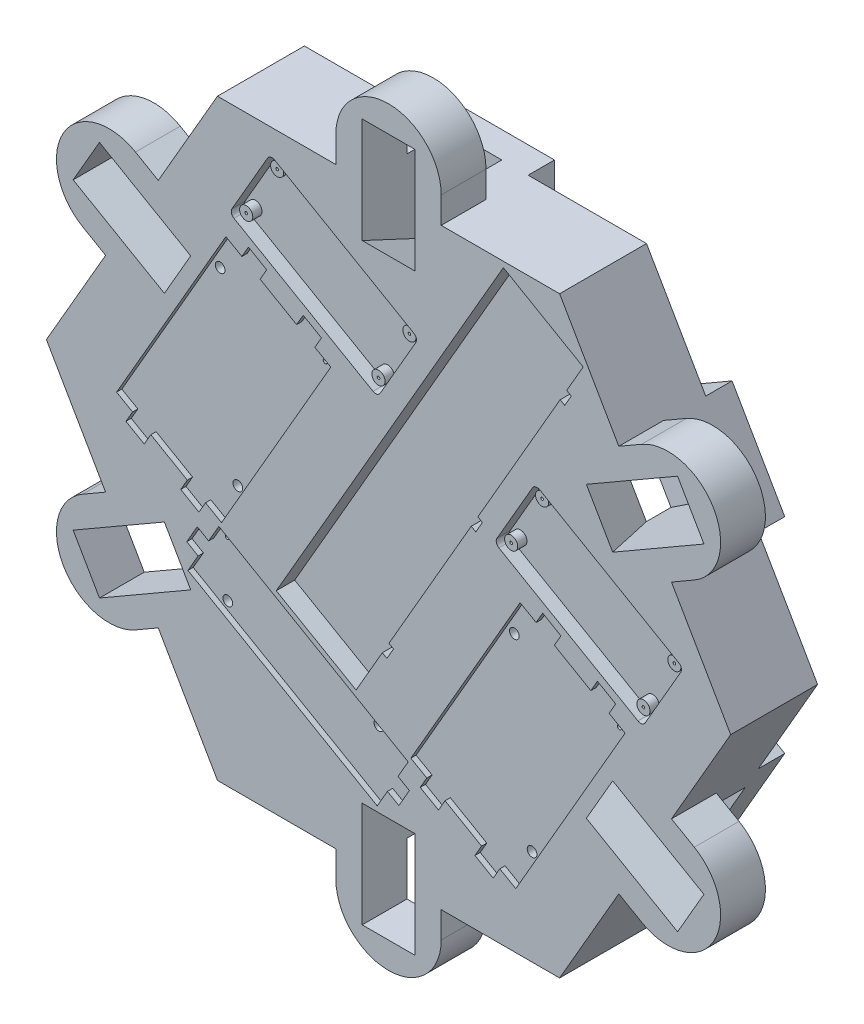
from build123d import *

# Parameters (mm, degrees)
MBODY_DEPTH             = 33
BOTTOMFLOOR_W           = 40
BOTTOMFLOOR_H           = 30
BODYBASE_DEPTH          = 10
SERVOCIRCLE_DEPTH       = 17
BBCUT_DEPTH             = 7
BATTCUT_DEPTH           = 2
BATTFIXTURE_START       = 27.5
BATTFIXTURE_OUTLINE_R   = 1.84
BATTFIXTURE_OUTLINE_R_2 = 0.785
BATTFIXTURE_DEPTH       = 3.5
PCACUT_DEPTH            = 5
SKETCH10_R              = 2.5
SKETCH10_R_2            = 0.5
PCAFIXTURE_DEPTH        = 3.5
HOLLOWBOTTOM_DEPTH      = 20
CUT_EXTRUDE2_DEPTH      = 20
CUT_EXTRUDE5_DEPTH      = 20
CUT_EXTRUDE6_DEPTH      = 20
CUT_EXTRUDE7_DEPTH      = 20
CUT_EXTRUDE8_DEPTH      = 20
CUT_EXTRUDE9_DEPTH      = 20
BOTTOMBATTCUT_DEPTH     = 2
SKETCH20_R              = 1.84
SKETCH20_R_2            = 0.785
BOTTOMBATTFIXTURE_DEPTH = 3.5


# Read off the part's stored shape, not the designer's step: BATTFIXTURE
with BuildPart() as part:
    # HEXAGON → MBODY (new body)
    with BuildSketch(Plane.XY):
        Polygon((85.10734985, -37.472778602), (102.427857926, -47.472778602), (129.903810568, 0.11696736), (102.427857926, 47.706713322), (85.10734985, 37.706713322), (75.10734985, 55.027221398), (92.427857926, 65.027221398), (64.951905284, 112.61696736), (10, 112.61696736), (10, 92.61696736), (-10, 92.61696736), (-10, 112.61696736), (-64.951905284, 112.61696736), (-92.427857926, 65.027221398), (-75.10734985, 55.027221398), (-85.10734985, 37.706713322), (-102.427857926, 47.706713322), (-129.903810568, 0.11696736), (-102.427857926, -47.472778602), (-85.10734985, -37.472778602), (-75.10734985, -54.793286678), (-92.427857926, -64.793286678), (-64.951905284, -112.38303264), (-10, -112.38303264), (-10, -92.38303264), (10, -92.38303264), (10, -112.38303264), (64.951905284, -112.38303264), (92.427857926, -64.793286678), (75.10734985, -54.793286678), align=None)
    extrude(amount=MBODY_DEPTH)

    # BottomFloor → BODYBASE (add)
    with BuildSketch(Plane.XY):
        with Locations((0, -97.38303264)):
            Rectangle(BOTTOMFLOOR_W, BOTTOMFLOOR_H)
        Polygon((87.427857926, -73.453540716), (107.427857926, -38.812524564), (81.447095812, -23.812524564), (61.447095812, -58.453540716), align=None)
        Polygon((-107.427857926, -38.812524564), (-87.427857926, -73.453540716), (-61.447095812, -58.453540716), (-81.447095812, -23.812524564), align=None)
        Polygon((-87.427857926, 73.687475436), (-107.427857926, 39.046459284), (-81.447095812, 24.046459284), (-61.447095812, 58.687475436), align=None)
        with Locations((0, 97.61696736)):
            Rectangle(BOTTOMFLOOR_W, BOTTOMFLOOR_H)
        Polygon((107.427857926, 39.046459284), (87.427857926, 73.687475436), (61.447095812, 58.687475436), (81.447095812, 24.046459284), align=None)
    extrude(amount=-BODYBASE_DEPTH)

    # CircleBits → SERVOCIRCLE (add)
    with BuildSketch(Plane.XY.offset(33)):
        with BuildLine():
            Line((-87.427857926, -73.453540716), (-96.088111964, -78.453540716))
            ThreePointArc((-96.088111964, -78.453540716), (-123.408620039, -71.13303264), (-116.088111964, -43.812524564))
            Line((-116.088111964, -43.812524564), (-107.427857926, -38.812524564))
            Line((-107.427857926, -38.812524564), (-102.427857926, -47.472778602))
            Line((-102.427857926, -47.472778602), (-119.748366001, -57.472778602))
            Line((-119.748366001, -57.472778602), (-109.748366001, -74.793286678))
            Line((-109.748366001, -74.793286678), (-92.427857926, -64.793286678))
            Line((-92.427857926, -64.793286678), (-87.427857926, -73.453540716))
        make_face()
        with BuildLine():
            Line((-20, 112.61696736), (-20, 122.61696736))
            ThreePointArc((-20, 122.61696736), (0, 142.61696736), (20, 122.61696736))
            Line((20, 122.61696736), (20, 112.61696736))
            Line((20, 112.61696736), (10, 112.61696736))
            Line((10, 112.61696736), (10, 132.61696736))
            Line((10, 132.61696736), (-10, 132.61696736))
            Line((-10, 132.61696736), (-10, 112.61696736))
            Line((-10, 112.61696736), (-20, 112.61696736))
        make_face()
        with BuildLine():
            Line((20, -112.38303264), (20, -122.38303264))
            ThreePointArc((20, -122.38303264), (0, -142.38303264), (-20, -122.38303264))
            Line((-20, -122.38303264), (-20, -112.38303264))
            Line((-20, -112.38303264), (-10, -112.38303264))
            Line((-10, -112.38303264), (-10, -132.38303264))
            Line((-10, -132.38303264), (10, -132.38303264))
            Line((10, -132.38303264), (10, -112.38303264))
            Line((10, -112.38303264), (20, -112.38303264))
        make_face()
        with BuildLine():
            Line((87.427857926, 73.687475436), (96.088111964, 78.687475436))
            ThreePointArc((96.088111964, 78.687475436), (123.408620039, 71.36696736), (116.088111964, 44.046459284))
            Line((116.088111964, 44.046459284), (107.427857926, 39.046459284))
            Line((107.427857926, 39.046459284), (102.427857926, 47.706713322))
            Line((102.427857926, 47.706713322), (119.748366001, 57.706713322))
            Line((119.748366001, 57.706713322), (109.748366001, 75.027221398))
            Line((109.748366001, 75.027221398), (92.427857926, 65.027221398))
            Line((92.427857926, 65.027221398), (87.427857926, 73.687475436))
        make_face()
        with BuildLine():
            Line((107.427857926, -38.812524564), (116.088111964, -43.812524564))
            ThreePointArc((116.088111964, -43.812524564), (123.408620039, -71.13303264), (96.088111964, -78.453540716))
            Line((96.088111964, -78.453540716), (87.427857926, -73.453540716))
            Line((87.427857926, -73.453540716), (92.427857926, -64.793286678))
            Line((92.427857926, -64.793286678), (109.748366001, -74.793286678))
            Line((109.748366001, -74.793286678), (119.748366001, -57.472778602))
            Line((119.748366001, -57.472778602), (102.427857926, -47.472778602))
            Line((102.427857926, -47.472778602), (107.427857926, -38.812524564))
        make_face()
        with BuildLine():
            Line((-107.427857926, 39.046459284), (-116.088111964, 44.046459284))
            ThreePointArc((-116.088111964, 44.046459284), (-123.408620039, 71.36696736), (-96.088111964, 78.687475436))
            Line((-96.088111964, 78.687475436), (-87.427857926, 73.687475436))
            Line((-87.427857926, 73.687475436), (-92.427857926, 65.027221398))
            Line((-92.427857926, 65.027221398), (-109.748366001, 75.027221398))
            Line((-109.748366001, 75.027221398), (-119.748366001, 57.706713322))
            Line((-119.748366001, 57.706713322), (-102.427857926, 47.706713322))
            Line((-102.427857926, 47.706713322), (-107.427857926, 39.046459284))
        make_face()
    extrude(amount=-SERVOCIRCLE_DEPTH)

    # Breadboard → BBCUT (cut)
    with BuildSketch(Plane.XY.offset(33)):
        Polygon((-12.320268887, -56.339331676), (-2.344555434, -39.060889132), (-0.612504626, -40.060889132), (1.887495374, -35.730762114), (0.155444566, -34.730762114), (31.405444566, 19.395825623), (33.137495374, 18.395825623), (35.637495374, 22.725952642), (33.905444566, 23.725952642), (65.155444566, 77.852540378), (66.887495374, 76.852540378), (69.387495374, 81.182667397), (67.655444566, 82.182667397), (73.905444566, 93.007984945), (43.594555434, 110.507984945), (-42.63115802, -38.839331676), align=None)
    extrude(amount=-BBCUT_DEPTH, mode=Mode.SUBTRACT)

    # Sketch6 → BATTCUT (cut)
    with BuildSketch(Plane.XY.offset(33)):
        Polygon((49.964340803, 3.540776838), (56.02651863, 0.040776838), (58.52651863, 4.370903857), (65.45472186, 0.370903857), (62.95472186, -3.959223162), (76.811128321, -11.959223162), (79.311128321, -7.629096143), (86.239331551, -11.629096143), (83.739331551, -15.959223162), (89.801509378, -19.459223162), (48.301509378, -91.339331676), (42.239331551, -87.839331676), (39.739331551, -92.169458695), (32.811128321, -88.169458695), (35.311128321, -83.839331676), (21.45472186, -75.839331676), (18.95472186, -80.169458695), (12.02651863, -76.169458695), (14.52651863, -71.839331676), (8.464340803, -68.339331676), align=None)
        Polygon((-64.415767711, -28.571382483), (7.464340803, -70.071382483), (3.589340803, -76.783079363), (7.919467822, -79.283079363), (3.919467822, -86.211282593), (-0.410659197, -83.711282593), (-4.285659197, -90.422979472), (-76.165767711, -48.922979472), (-72.290767711, -42.211282593), (-76.62089473, -39.711282593), (-72.62089473, -32.783079363), (-68.290767711, -35.283079363), align=None)
        Polygon((-61.752936285, 68.040776838), (-55.690758458, 64.540776838), (-53.190758458, 68.870903857), (-46.262555228, 64.870903857), (-48.762555228, 60.540776838), (-34.906148767, 52.540776838), (-32.406148767, 56.870903857), (-25.477945537, 52.870903857), (-27.977945537, 48.540776838), (-21.915767711, 45.040776838), (-63.415767711, -26.839331676), (-69.477945537, -23.339331676), (-71.977945537, -27.669458695), (-78.906148767, -23.669458695), (-76.406148767, -19.339331676), (-90.262555228, -11.339331676), (-92.762555228, -15.669458695), (-99.690758458, -11.669458695), (-97.190758458, -7.339331676), (-103.252936285, -3.839331676), align=None)
    extrude(amount=-BATTCUT_DEPTH, mode=Mode.SUBTRACT)

    # BATTFIXTURE outline → BATTFIXTURE (cut)
    with BuildSketch(Plane.XY.offset(BATTFIXTURE_START)):
        with Locations((45.774917015, -9.715518018)):
            Circle(BATTFIXTURE_OUTLINE_R)
        with Locations((85.690933166, -20.578950008)):
            Circle(BATTFIXTURE_OUTLINE_R_2)
        with Locations((52.490933166, -78.083036819)):
            Circle(BATTFIXTURE_OUTLINE_R)
        with Locations((-59.226343922, -13.583036819)):
            Circle(BATTFIXTURE_OUTLINE_R)
        with Locations((-65.942360073, 54.784481982)):
            Circle(BATTFIXTURE_OUTLINE_R)
        with Locations((-26.026343922, 43.921049992)):
            Circle(BATTFIXTURE_OUTLINE_R_2)
        with Locations((-63.034472854, -53.328909612)):
            Circle(BATTFIXTURE_OUTLINE_R)
        with Locations((-63.171040864, -32.465452344)):
            Circle(BATTFIXTURE_OUTLINE_R_2)
        with Locations((-5.666954053, -65.665452344)):
            Circle(BATTFIXTURE_OUTLINE_R)
    extrude(amount=BATTFIXTURE_DEPTH, mode=Mode.SUBTRACT)

    # Sketch9 → PCACUT (cut)
    with BuildSketch(Plane.XY.offset(33)):
        with BuildLine():
            Line((97.442556229, -12.241945402), (110.942556229, 11.1407405))
            ThreePointArc((110.942556229, 11.1407405), (111.142357074, 12.65837859), (110.210505422, 13.872791308))
            Line((110.210505422, 13.872791308), (57.382955791, 44.372791308))
            ThreePointArc((57.382955791, 44.372791308), (55.865317701, 44.572592153), (54.650904983, 43.6407405))
            Line((54.650904983, 43.6407405), (41.150904983, 20.258054598))
            ThreePointArc((41.150904983, 20.258054598), (40.951104138, 18.740416508), (41.882955791, 17.52600379))
            Line((41.882955791, 17.52600379), (94.710505422, -12.97399621))
            ThreePointArc((94.710505422, -12.97399621), (96.228143512, -13.173797055), (97.442556229, -12.241945402))
        make_face()
        with BuildLine():
            Line((-3.161992845, 45.843775815), (10.338007155, 69.226461717))
            ThreePointArc((10.338007155, 69.226461717), (10.537808, 70.744099807), (9.605956347, 71.958512525))
            Line((9.605956347, 71.958512525), (-43.221593284, 102.458512525))
            ThreePointArc((-43.221593284, 102.458512525), (-44.739231374, 102.65831337), (-45.953644091, 101.726461717))
            Line((-45.953644091, 101.726461717), (-59.453644091, 78.343775815))
            ThreePointArc((-59.453644091, 78.343775815), (-59.653444936, 76.826137725), (-58.721593284, 75.611725007))
            Line((-58.721593284, 75.611725007), (-5.894043653, 45.111725007))
            ThreePointArc((-5.894043653, 45.111725007), (-4.376405562, 44.911924162), (-3.161992845, 45.843775815))
        make_face()
    extrude(amount=-PCACUT_DEPTH, mode=Mode.SUBTRACT)

    # Sketch10 → PCAFIXTURE (add)
    # profile 1 of 8: a face of its own
    with BuildSketch(Plane.XY.offset(28)):
        with Locations((107.036467316, 11.375196043)):
            Circle(SKETCH10_R)
        with Locations((107.036467316, 11.375196043)):
            Circle(SKETCH10_R_2, mode=Mode.SUBTRACT)
    # profile 2 of 8: a face of its own
    with BuildSketch(Plane.XY.offset(28)):
        with Locations((95.286467316, -8.976400945)):
            Circle(SKETCH10_R)
        with Locations((95.286467316, -8.976400945)):
            Circle(SKETCH10_R_2, mode=Mode.SUBTRACT)
    # profile 3 of 8: a face of its own
    with BuildSketch(Plane.XY.offset(28)):
        with Locations((45.056993897, 20.023599055)):
            Circle(SKETCH10_R)
        with Locations((45.056993897, 20.023599055)):
            Circle(SKETCH10_R_2, mode=Mode.SUBTRACT)
    # profile 4 of 8: a face of its own
    with BuildSketch(Plane.XY.offset(28)):
        with Locations((56.806993897, 40.375196043)):
            Circle(SKETCH10_R)
        with Locations((56.806993897, 40.375196043)):
            Circle(SKETCH10_R_2, mode=Mode.SUBTRACT)
    # profile 5 of 8: a face of its own
    with BuildSketch(Plane.XY.offset(28)):
        with Locations((6.431918242, 69.46091726)):
            Circle(SKETCH10_R)
        with Locations((6.431918242, 69.46091726)):
            Circle(SKETCH10_R_2, mode=Mode.SUBTRACT)
    # profile 6 of 8: a face of its own
    with BuildSketch(Plane.XY.offset(28)):
        with Locations((-5.318081758, 49.109320271)):
            Circle(SKETCH10_R)
        with Locations((-5.318081758, 49.109320271)):
            Circle(SKETCH10_R_2, mode=Mode.SUBTRACT)
    # profile 7 of 8: a face of its own
    with BuildSketch(Plane.XY.offset(28)):
        with Locations((-55.547555178, 78.109320271)):
            Circle(SKETCH10_R)
        with Locations((-55.547555178, 78.109320271)):
            Circle(SKETCH10_R_2, mode=Mode.SUBTRACT)
    # profile 8 of 8: a face of its own
    with BuildSketch(Plane.XY.offset(28)):
        with Locations((-43.797555178, 98.46091726)):
            Circle(SKETCH10_R)
        with Locations((-43.797555178, 98.46091726)):
            Circle(SKETCH10_R_2, mode=Mode.SUBTRACT)
    extrude(amount=PCAFIXTURE_DEPTH)

    # Sketch16 → HOLLOWBOTTOM (cut)
    with BuildSketch(Plane(origin=(0, 0, 0), x_dir=(-1, 0, 0), z_dir=(0, 0, -1))):
        Polygon((-47.631397208, -82.38303264), (-61.447095812, -58.453540716), (-81.447095812, -23.812524564), (-95.262794416, 0.11696736), (-81.447095812, 24.046459284), (-61.447095812, 58.687475436), (-47.631397208, 82.61696736), (-20, 82.61696736), (20, 82.61696736), (47.631397208, 82.61696736), (61.447095812, 58.687475436), (81.447095812, 24.046459284), (95.262794416, 0.11696736), (81.447095812, -23.812524564), (61.447095812, -58.453540716), (47.631397208, -82.38303264), (20, -82.38303264), (-20, -82.38303264), align=None)
    extrude(amount=-HOLLOWBOTTOM_DEPTH, mode=Mode.SUBTRACT)

    # Sketch17 → Cut-Extrude2 (cut)
    with BuildSketch(Plane(origin=(10, 0, 0), x_dir=(0, -1, 0), z_dir=(-1, 0, 0))):
        Polygon((92.38303264, 0), (92.38303264, 33), (78.436630003, 3.091843028), align=None)
    extrude(amount=CUT_EXTRUDE2_DEPTH, mode=Mode.SUBTRACT)

    # Sketch21 → Cut-Extrude5 (cut)
    with BuildSketch(Plane(origin=(4.949351647, -8.572528518, 9.898703295), x_dir=(-0.4330127018922194, -0.2500000000000001, -0.8660254037844387), z_dir=(0.5000000000000001, -0.8660254037844386, 0))):
        Polygon((45.142470753, -64.575332389), (26.214448353, -91.60734985), (54.793286678, -75.10734985), align=None)
    extrude(amount=-CUT_EXTRUDE5_DEPTH, mode=Mode.SUBTRACT)

    # Sketch22 → Cut-Extrude6 (cut)
    with BuildSketch(Plane(origin=(-128.320894519, 62.65606497, 33), x_dir=(0.7499999999999993, -0.433012701892219, -0.5000000000000012), z_dir=(-0.5000000000000001, -0.8660254037844386, 0))):
        Polygon((70.245562131, 6.021329248), (43.213544669, 24.949351647), (59.713544669, -3.629486677), align=None)
    extrude(amount=-CUT_EXTRUDE6_DEPTH, mode=Mode.SUBTRACT)

    # Sketch23 → Cut-Extrude7 (cut)
    with BuildSketch(Plane(origin=(-10, -33, 165.457186975), x_dir=(-1.3877787807814417e-15, 0.49999999999999906, -0.8660254037844393), z_dir=(-1, 0, 0))):
        Polygon((196.447794914, -15.526873931), (177.519772514, -42.558891393), (206.098610839, -26.058891393), align=None)
    extrude(amount=-CUT_EXTRUDE7_DEPTH, mode=Mode.SUBTRACT)

    # Sketch24 → Cut-Extrude8 (cut)
    with BuildSketch(Plane(origin=(-143.432957746, -71.147084022, -44.048458457), x_dir=(0.8660254037844378, 0.5000000000000017, 0), z_dir=(0.5000000000000016, -0.8660254037844377, 0))):
        Polygon((252.348610839, 44.048458457), (252.348610839, 77.048458457), (238.402208201, 47.140301485), align=None)
    extrude(amount=CUT_EXTRUDE8_DEPTH, mode=Mode.SUBTRACT)

    # Sketch25 → Cut-Extrude9 (cut)
    with BuildSketch(Plane(origin=(105.819701711, -49.431060525, -74.940850896), x_dir=(-0.75, 0.43301270189221946, 0.49999999999999994), z_dir=(0.5000000000000001, 0.8660254037844386, 0))):
        Polygon((71.806637798, 48.646812023), (74.682777309, 81.52123706), (58.182777309, 52.942398735), align=None)
    extrude(amount=-CUT_EXTRUDE9_DEPTH, mode=Mode.SUBTRACT)

    # Sketch18 → BOTTOMBATTCUT (cut)
    with BuildSketch(Plane.XY.offset(20)):
        Polygon((30.830127019, 43.516313761), (36.892304845, 40.016313761), (39.392304845, 44.346440779), (46.320508076, 40.346440779), (43.820508076, 36.016313761), (57.676914536, 28.016313761), (60.176914536, 32.346440779), (67.105117767, 28.346440779), (64.605117767, 24.016313761), (70.667295593, 20.516313761), (29.167295593, -51.363794754), (23.105117767, -47.863794754), (20.605117767, -52.193921772), (13.676914536, -48.193921772), (16.176914536, -43.863794754), (2.320508076, -35.863794754), (-0.179491924, -40.193921772), (-7.107695155, -36.193921772), (-4.607695155, -31.863794754), (-10.669872981, -28.363794754), align=None)
        Polygon((-56.40217363, -14.574463024), (15.477934884, -56.074463024), (11.602934884, -62.786159903), (15.933061903, -65.286159903), (11.933061903, -72.214363133), (7.602934884, -69.714363133), (3.727934884, -76.426060013), (-68.15217363, -34.926060013), (-64.27717363, -28.214363133), (-68.607300649, -25.714363133), (-64.607300649, -18.786159903), (-60.27717363, -21.286159903), align=None)
        Polygon((-17.688048388, 71.480019271), (-11.625870562, 67.980019271), (-9.125870562, 72.31014629), (-2.197667331, 68.31014629), (-4.697667331, 63.980019271), (9.158739129, 55.980019271), (11.658739129, 60.31014629), (18.586942359, 56.31014629), (16.086942359, 51.980019271), (22.149120186, 48.480019271), (-19.350879814, -23.400089243), (-25.413057641, -19.900089243), (-27.913057641, -24.230216262), (-34.841260871, -20.230216262), (-32.341260871, -15.900089243), (-46.197667331, -7.900089243), (-48.697667331, -12.230216262), (-55.625870562, -8.230216262), (-53.125870562, -3.900089243), (-59.188048388, -0.400089243), align=None)
    extrude(amount=BOTTOMBATTCUT_DEPTH, mode=Mode.SUBTRACT)

    # Sketch20 → BOTTOMBATTFIXTURE (cut)
    with BuildSketch(Plane(origin=(0, 0, 22), x_dir=(-1, 0, 0), z_dir=(0, 0, -1))):
        with Locations((1.28429677, -18.107499897)):
            Circle(SKETCH20_R)
        with Locations((-61.281719382, 10.260018904)):
            Circle(SKETCH20_R)
        with Locations((-31.91570323, 39.396586914)):
            Circle(SKETCH20_R_2)
        with Locations((49.802472177, 9.856205613)):
            Circle(SKETCH20_R)
        with Locations((-12.763543974, 38.223724415)):
            Circle(SKETCH20_R)
        with Locations((16.602472177, 67.360292425)):
            Circle(SKETCH20_R_2)
        with Locations((-11.483208038, -56.943532884)):
            Circle(SKETCH20_R_2)
        with Locations((6.653359972, -67.256990152)):
            Circle(SKETCH20_R)
        with Locations((46.020878773, -23.743532884)):
            Circle(SKETCH20_R)
    extrude(amount=-BOTTOMBATTFIXTURE_DEPTH, mode=Mode.SUBTRACT)


solid = part.part
